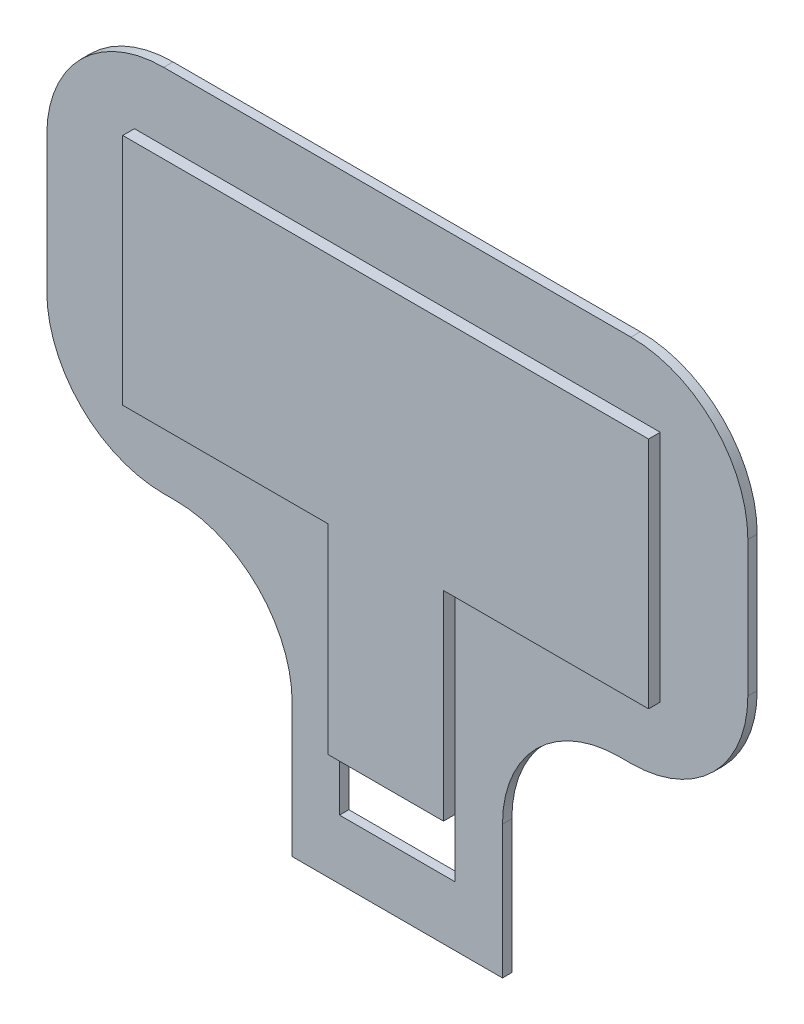
from build123d import *

# Parameters (mm, degrees)
SKETCH1_W           = 60
SKETCH1_H           = 53
BOSS_EXTRUDE1_DEPTH = 0.8
CUT_EXTRUDE2_DEPTH  = 0.8
BOSS_EXTRUDE2_DEPTH = 1
SKETCH4_W           = 9.9
SKETCH4_H           = 5
CUT_EXTRUDE3_DEPTH  = 10


with BuildPart() as part:
    # Sketch1 → Boss-Extrude1 (new body)
    with BuildSketch(Plane.XY):
        with Locations((30, 26.5)):
            Rectangle(SKETCH1_W, SKETCH1_H)
    extrude(amount=BOSS_EXTRUDE1_DEPTH)

    # Sketch2 → Cut-Extrude2 (cut)
    with BuildSketch(Plane.XY.offset(0.8)):
        with BuildLine():
            ThreePointArc((0, 43), (2.928932188, 50.071067812), (10, 53))
            Line((10, 53), (0, 53))
            Line((0, 53), (0, 43))
        make_face()
        with BuildLine():
            Line((60, 53), (50, 53))
            ThreePointArc((50, 53), (57.071067812, 50.071067812), (60, 43))
            Line((60, 43), (60, 53))
        make_face()
        with BuildLine():
            ThreePointArc((10, 21.4), (2.928932188, 24.328932188), (0, 31.4))
            Line((0, 31.4), (0, 0))
            Line((0, 0), (21, 0))
            Line((21, 0), (21, 11.4))
            ThreePointArc((21, 11.4), (18.071067812, 18.471067812), (11, 21.4))
            Line((11, 21.4), (10, 21.4))
        make_face()
        with BuildLine():
            Line((60, 0), (60, 31.4))
            ThreePointArc((60, 31.4), (57.071067812, 24.328932188), (50, 21.4))
            Line((50, 21.4), (49, 21.4))
            ThreePointArc((49, 21.4), (41.928932188, 18.471067812), (39, 11.4))
            Line((39, 11.4), (39, 0))
            Line((39, 0), (60, 0))
        make_face()
    extrude(amount=-CUT_EXTRUDE2_DEPTH, mode=Mode.SUBTRACT)

    # Sketch3 → Boss-Extrude2 (add)
    with BuildSketch(Plane.XY.offset(0.8)):
        Polygon((25.05, 27.2), (25.05, 5.1), (34.95, 5.1), (34.95, 27.2), (52.5, 27.2), (52.5, 47.2), (7.5, 47.2), (7.5, 27.2), align=None)
    extrude(amount=BOSS_EXTRUDE2_DEPTH)

    # Sketch4 → Cut-Extrude3 (cut)
    with BuildSketch(Plane.XY.offset(1.8)):
        with Locations((30, 7.6)):
            Rectangle(SKETCH4_W, SKETCH4_H)
    extrude(amount=-CUT_EXTRUDE3_DEPTH, mode=Mode.SUBTRACT)


solid = part.part
